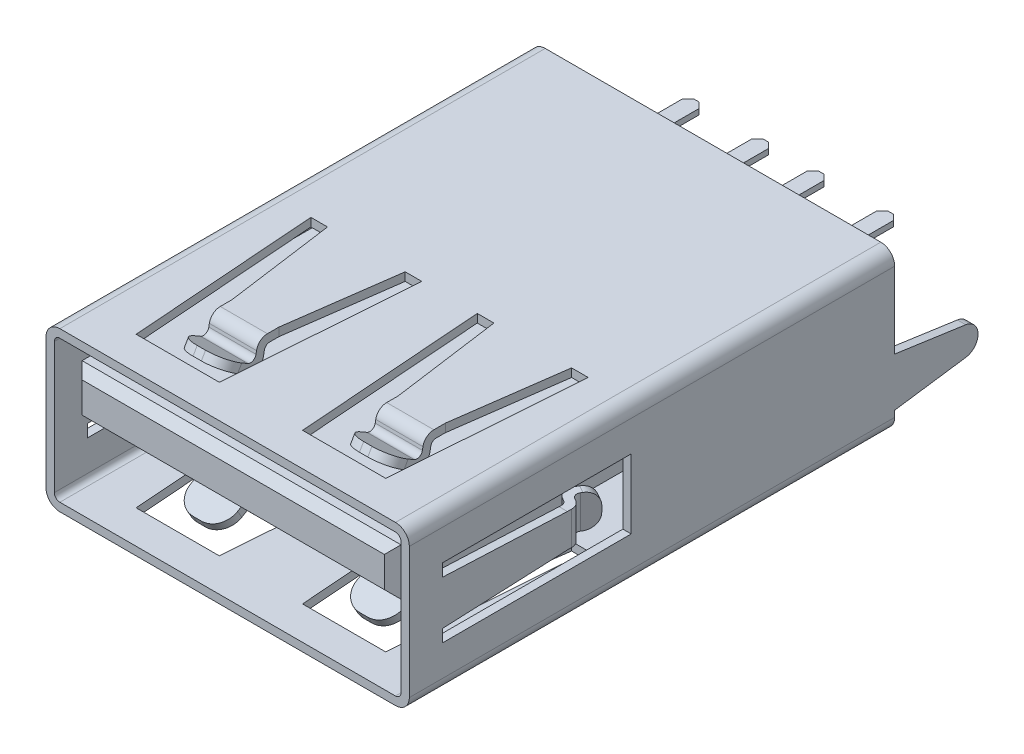
from build123d import *

# Parameters (mm, degrees)
SKETCH_1_W             = 13.1
SKETCH_1_H             = 5.72
EXTRUDE_1_DEPTH        = 17.5
FILLET_1_R             = 0.5
SHELL_1_T              = -0.3
CUT_EXTRUDE_1_DEPTH    = 20.541517341
EXTRUDE_2_DEPTH        = 0.85
FILLET_2_R             = 0.7
FILLET_2_OF_MIRROR_1_R = 0.7
CUT_EXTRUDE_2_DEPTH    = 23.046305813
EXTRUDE_3_DEPTH        = 0.6
FILLET_3_R             = 0.5
FILLET_3_OF_MIRROR_4_R = 0.5
SKETCH_6_W             = 11.5
SKETCH_6_H             = 1.7
EXTRUDE_4_DEPTH        = 17
CHAMFER_1_SIZE         = 0.3
EXTRUDE_START          = 5
EXTRUDE_5_DEPTH        = 5
SKETCH_9_W             = 0.6
SKETCH_9_H             = 0.2
EXTRUDE_6_DEPTH        = 2.9
EXTRUDE_7_DEPTH        = 0.3
SKETCH_8_W             = 1.5
SKETCH_8_H             = 6
EXTRUDE_8_DEPTH        = 0.05
CHAMFER_2_SIZE         = 0.2


# Read off the part's stored shape, not the designer's step: Зеркальное отражение3
with BuildPart() as part:
    # Эскиз1 → Бобышка-Вытянуть1 (new body)
    with BuildSketch(Plane.XY):
        Rectangle(SKETCH_1_W, SKETCH_1_H)
    extrude(amount=EXTRUDE_1_DEPTH)

    # Скругление1
    fillet_1_edges = [part.edges().sort_by_distance(p)[0] for p in [
        (6.55, -2.86, 8.75),
        (-6.55, -2.86, 8.75),
        (-6.55, 2.86, 8.75),
        (6.55, 2.86, 8.75),
    ]]
    fillet(fillet_1_edges, radius=FILLET_1_R)

    # Оболочка1
    shell_1_openings = [part.faces().sort_by_distance(p)[0] for p in [
        (0, 0, 17.5),
    ]]
    offset(amount=SHELL_1_T, openings=shell_1_openings, kind=Kind.INTERSECTION)

    # Эскиз2 → Вырез-Вытянуть1 (cut, through all)
    with BuildSketch(Plane(origin=(0, 2.86, 0), x_dir=(1, 0, 0), z_dir=(0, 1, 0))):
        Polygon((4.5, -16.3), (1.5, -16.3), (1, -9.5), (1.6, -9.5), (2.15, -13.5), (3.85, -13.5), (4.4, -9.5), (5, -9.5), align=None)
        Polygon((-5, -9.5), (-4.4, -9.5), (-3.85, -13.5), (-2.15, -13.5), (-1.6, -9.5), (-1, -9.5), (-1.5, -16.3), (-4.5, -16.3), align=None)
    extrude(amount=-CUT_EXTRUDE_1_DEPTH, mode=Mode.SUBTRACT)

    # Эскиз3 → Бобышка-Вытянуть2 (add, symmetric)
    with BuildSketch(Plane(origin=(3, 0, 0), x_dir=(0, 0, -1), z_dir=(1, 0, 0))):
        with BuildLine():
            Line((-14.029141624, 2.394729636), (-14.05806209, 2.230713527))
            ThreePointArc((-14.05806209, 2.230713527), (-14.282937886, 1.937649684), (-14.651985191, 1.953762637))
            Line((-14.651985191, 1.953762637), (-15.597988535, 2.499937922))
            Line((-15.597988535, 2.499937922), (-15.447988535, 2.759745544))
            Line((-15.447988535, 2.759745544), (-14.625666436, 2.284977658))
            ThreePointArc((-14.625666436, 2.284977658), (-14.441142784, 2.276921182), (-14.328704886, 2.423453104))
            Line((-14.328704886, 2.423453104), (-14.310013138, 2.529459271))
            ThreePointArc((-14.310013138, 2.529459271), (-14.173205081, 2.766417777), (-13.916090037, 2.86))
            Line((-13.916090037, 2.86), (-13.5, 2.86))
            Line((-13.5, 2.86), (-13.5, 2.56))
            Line((-13.5, 2.56), (-13.832180074, 2.56))
            ThreePointArc((-13.832180074, 2.56), (-13.960737596, 2.513208889), (-14.029141624, 2.394729636))
        make_face()
    extrude_2 = extrude(amount=EXTRUDE_2_DEPTH, both=True)

    # Скругление2
    fillet_2_edges = [part.edges().sort_by_distance(p)[0] for p in [
        (2.15, 2.629841733, 15.522988535),
        (3.85, 2.629841733, 15.522988535),
    ]]
    fillet(fillet_2_edges, radius=FILLET_2_R)

    # Зеркальное отражение1: Бобышка-Вытянуть2 across plane
    add(extrude_2.mirror(Plane(origin=(0, 0, 0), x_dir=(0, 0, 1), z_dir=(1, 0, 0))))

    # Скругление2 of Зеркальное отражение1
    fillet_2_of_mirror_1_edges = [part.edges().sort_by_distance(p)[0] for p in [
        (-2.15, 2.629841733, 15.522988535),
        (-3.85, 2.629841733, 15.522988535),
    ]]
    fillet(fillet_2_of_mirror_1_edges, radius=FILLET_2_OF_MIRROR_1_R)

    # Зеркальное отражение3: part across plane


with BuildPart() as part_1:
    add(part.part)
    add(part.part.mirror(Plane.ZX))

    # Эскиз4 → Вырез-Вытянуть2 (cut, through all)
    with BuildSketch(Plane.ZY.offset(6.55)):
        Polygon((9.5, 1.25), (16.3, 1.25), (16.3, 0.8), (11.8, 0.6), (11.8, -0.6), (16.3, -0.8), (16.3, -1.25), (9.5, -1.25), align=None)
    extrude(amount=-CUT_EXTRUDE_2_DEPTH, mode=Mode.SUBTRACT)

    # Эскиз5 → Бобышка-Вытянуть3 (add, symmetric)
    with BuildSketch(Plane(origin=(0, 0, 0), x_dir=(1, 0, 0), z_dir=(0, 1, 0))):
        with BuildLine():
            Line((-6.25, -11.8), (-6.25, -11.705910296))
            ThreePointArc((-6.25, -11.705910296), (-6.223205081, -11.605910296), (-6.15, -11.532705215))
            Line((-6.15, -11.532705215), (-6.034842252, -11.466218859))
            ThreePointArc((-6.034842252, -11.466218859), (-5.848471922, -11.223336315), (-5.888432091, -10.919808697))
            Line((-5.888432091, -10.919808697), (-6.222042476, -10.34197856))
            Line((-6.222042476, -10.34197856), (-6.481850098, -10.49197856))
            Line((-6.481850098, -10.49197856), (-6.198239712, -10.983206157))
            ThreePointArc((-6.198239712, -10.983206157), (-6.178259628, -11.134969966), (-6.271444793, -11.256411238))
            Line((-6.271444793, -11.256411238), (-6.35, -11.301765108))
            ThreePointArc((-6.35, -11.301765108), (-6.496410162, -11.448175269), (-6.55, -11.648175269))
            Line((-6.55, -11.648175269), (-6.55, -11.8))
            Line((-6.55, -11.8), (-6.25, -11.8))
        make_face()
    extrude_3 = extrude(amount=EXTRUDE_3_DEPTH, both=True)

    # Скругление3
    fillet_3_edges = [part_1.edges().sort_by_distance(p)[0] for p in [
        (-6.351946287, -0.6, 10.41697856),
        (-6.351946287, 0.6, 10.41697856),
    ]]
    fillet(fillet_3_edges, radius=FILLET_3_R)

    # Зеркальное отражение4: Бобышка-Вытянуть3 across plane
    add(extrude_3.mirror(Plane(origin=(0, 0, 0), x_dir=(0, 0, 1), z_dir=(1, 0, 0))))

    # Скругление3 of Зеркальное отражение4
    fillet_3_of_mirror_4_edges = [part_1.edges().sort_by_distance(p)[0] for p in [
        (6.351946287, -0.6, 10.41697856),
        (6.351946287, 0.6, 10.41697856),
    ]]
    fillet(fillet_3_of_mirror_4_edges, radius=FILLET_3_OF_MIRROR_4_R)

    # Эскиз6 → Бобышка-Вытянуть4 (add)
    with BuildSketch(Plane.XY.offset(0.3)):
        with Locations((0, 0.91)):
            Rectangle(SKETCH_6_W, SKETCH_6_H)
    extrude(amount=EXTRUDE_4_DEPTH)

    # Фаска1
    chamfer_1_edges = [part_1.edges().sort_by_distance(p)[0] for p in [
        (5.75, 0.91, 17.3),
        (0, 1.76, 17.3),
        (-5.75, 0.91, 17.3),
        (0, 0.06, 17.3),
    ]]
    chamfer(chamfer_1_edges, length=CHAMFER_1_SIZE)

    # Эскиз7 → Бобышка-Вытянуть5 (add)
    with BuildSketch(Plane.XY.offset(0.3).offset(EXTRUDE_START)):
        with BuildLine():
            Line((6.25, -2.36), (6.25, 2.36))
            ThreePointArc((6.25, 2.36), (6.191421356, 2.501421356), (6.05, 2.56))
            Line((6.05, 2.56), (-6.05, 2.56))
            ThreePointArc((-6.05, 2.56), (-6.191421356, 2.501421356), (-6.25, 2.36))
            Line((-6.25, 2.36), (-6.25, -2.36))
            ThreePointArc((-6.25, -2.36), (-6.191421356, -2.501421356), (-6.05, -2.56))
            Line((-6.05, -2.56), (6.05, -2.56))
            ThreePointArc((6.05, -2.56), (6.191421356, -2.501421356), (6.25, -2.36))
        make_face()
    extrude(amount=-EXTRUDE_5_DEPTH)

    # Эскиз9 → Бобышка-Вытянуть6 (add)
    with BuildSketch(Plane(origin=(0, 0, 0), x_dir=(-1, 0, 0), z_dir=(0, 0, -1))):
        with Locations((3.5, 0.96)):
            Rectangle(SKETCH_9_W, SKETCH_9_H)
        with Locations((1, 0.96)):
            Rectangle(SKETCH_9_W, SKETCH_9_H)
        with Locations((-1, 0.96)):
            Rectangle(SKETCH_9_W, SKETCH_9_H)
        with Locations((-3.5, 0.96)):
            Rectangle(SKETCH_9_W, SKETCH_9_H)
    extrude(amount=EXTRUDE_6_DEPTH)

    # Эскиз10 → Бобышка-Вытянуть7 (add)
    with BuildSketch(Plane(origin=(6.55, 0, 0), x_dir=(0, 0, -1), z_dir=(1, 0, 0))):
        with BuildLine():
            Line((0, -2.136444595), (2.560954832, -1.771372579))
            ThreePointArc((2.560954832, -1.771372579), (3.004599438, -1.26), (2.560954832, -0.748627421))
            Line((2.560954832, -0.748627421), (0, -0.383555405))
            Line((0, -0.383555405), (0, -2.136444595))
        make_face()
    extrude_7 = extrude(amount=-EXTRUDE_7_DEPTH)

    # Зеркальное отражение5: Бобышка-Вытянуть7 across plane
    add(extrude_7.mirror(Plane(origin=(0, 0, 0), x_dir=(0, 0, 1), z_dir=(1, 0, 0))))

    # Эскиз8 → Бобышка-Вытянуть8 (add)
    with BuildSketch(Plane.XZ.offset(-0.06)):
        with Locations((-3.81, 13)):
            Rectangle(SKETCH_8_W, SKETCH_8_H)
        with Locations((3.81, 13)):
            Rectangle(SKETCH_8_W, SKETCH_8_H)
        with Locations((1.27, 13)):
            Rectangle(SKETCH_8_W, SKETCH_8_H)
        with Locations((-1.27, 13)):
            Rectangle(SKETCH_8_W, SKETCH_8_H)
    extrude(amount=EXTRUDE_8_DEPTH)

    # Фаска2
    chamfer_2_edges = [part_1.edges().sort_by_distance(p)[0] for p in [
        (-3.2, 0.96, -2.9),
        (-3.8, 0.96, -2.9),
        (-0.7, 0.96, -2.9),
        (-1.3, 0.96, -2.9),
        (1.3, 0.96, -2.9),
        (0.7, 0.96, -2.9),
        (3.8, 0.96, -2.9),
        (3.2, 0.96, -2.9),
    ]]
    chamfer(chamfer_2_edges, length=CHAMFER_2_SIZE)


solid = part_1.part
